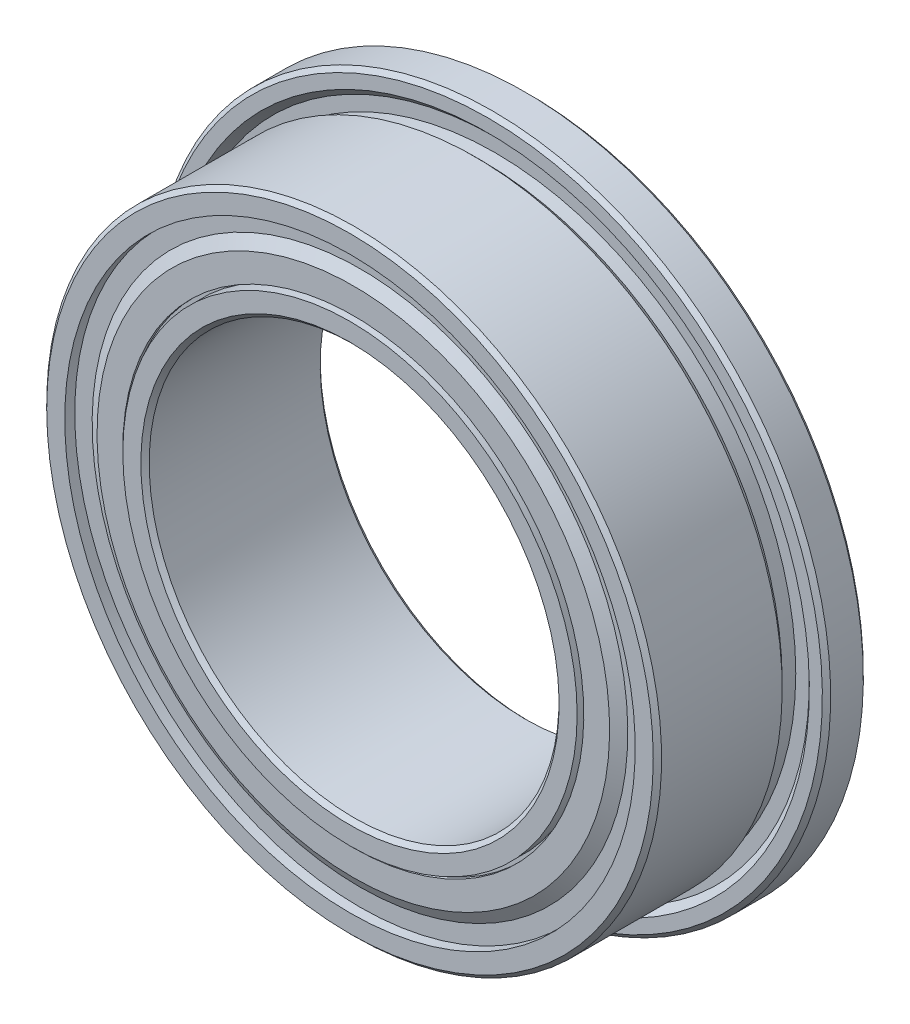
from build123d import *

# Parameters (mm, degrees)
FILLET1_SIZE      = 0.08125
FILLET2_SIZE      = 0.08125
CIRPATTERN3_COUNT = 22
SKETCH8_W         = 0.26
SKETCH8_H         = 0.216666667


with BuildPart() as part:
    # Sketch2 → Revolve1 (revolve)
    with BuildSketch(Plane(origin=(0, 0, 0), x_dir=(0, 0, -1), z_dir=(1, 0, 0))):
        with BuildLine():
            Line((1.75, 6.6), (0.95, 6.6))
            Line((0.95, 6.6), (0.95, 6.265165043))
            Line((0.95, 6.265165043), (1.082582521, 6.132582521))
            Line((1.082582521, 6.132582521), (1.082582521, 5.867417479))
            Line((1.082582521, 5.867417479), (0.817417479, 5.867417479))
            Line((0.817417479, 5.867417479), (0.684834957, 6))
            Line((0.684834957, 6), (-1.75, 6))
            Line((-1.75, 6), (-1.75, 5.35))
            Line((-1.75, 5.35), (-0.487339717, 5.35))
            ThreePointArc((-0.487339717, 5.35), (0, 5.6), (0.487339717, 5.35))
            Line((0.487339717, 5.35), (1.75, 5.35))
            Line((1.75, 5.35), (1.75, 6.6))
        make_face()
        with BuildLine():
            Line((1.75, 4), (-1.75, 4))
            Line((-1.75, 4), (-1.75, 4.65))
            Line((-1.75, 4.65), (-0.487339717, 4.65))
            ThreePointArc((-0.487339717, 4.65), (0, 4.4), (0.487339717, 4.65))
            Line((0.487339717, 4.65), (1.75, 4.65))
            Line((1.75, 4.65), (1.75, 4))
        make_face()
    revolve(axis=Axis((0, 0, 0), (0, 0, -1)))

    # Fillet1
    fillet1_edges = [part.edges().sort_by_distance(p)[0] for p in [
        (0, -6.6, -1.75),
        (0, -6.6, -0.95),
        (0, -6, 1.75),
    ]]
    chamfer(fillet1_edges, length=FILLET1_SIZE)

    # Fillet2
    fillet2_edges = [part.edges().sort_by_distance(p)[0] for p in [
        (0, -4, -1.75),
        (0, -4, 1.75),
    ]]
    chamfer(fillet2_edges, length=FILLET2_SIZE)

    # Sketch8 → Cut-Revolve1 (revolve, cut)
    with BuildSketch(Plane(origin=(0, 0, 0), x_dir=(0, 0, -1), z_dir=(1, 0, 0))):
        with Locations((-1.62, 5.458333334)):
            Rectangle(SKETCH8_W, SKETCH8_H)
        with Locations((1.62, 5.458333334)):
            Rectangle(SKETCH8_W, SKETCH8_H)
        with Locations((1.62, 4.541666667)):
            Rectangle(SKETCH8_W, SKETCH8_H)
        with Locations((-1.62, 4.541666667)):
            Rectangle(SKETCH8_W, SKETCH8_H)
    revolve(axis=Axis((0, 0, 0), (0, 0, -1)), mode=Mode.SUBTRACT)


with BuildPart() as body_2:
    # Sketch7 → Revolve3 (revolve)
    with BuildSketch(Plane.XY):
        with BuildLine():
            Line((0, 5.6), (0, 4.4))
            ThreePointArc((0, 4.4), (-0.6, 5), (0, 5.6))
        make_face()
    revolve(axis=Axis((0, 5.6, 0), (0, -1, 0)))


with BuildPart() as cirpattern3_1:
    # CirPattern3: pattern copy
    add(body_2.part.rotate(Axis((0, 0, 0), (0, 0, -1)), 1 * 360 / CIRPATTERN3_COUNT))


with BuildPart() as cirpattern3_2:
    # CirPattern3: pattern copy
    add(body_2.part.rotate(Axis((0, 0, 0), (0, 0, -1)), 2 * 360 / CIRPATTERN3_COUNT))


with BuildPart() as cirpattern3_3:
    # CirPattern3: pattern copy
    add(body_2.part.rotate(Axis((0, 0, 0), (0, 0, -1)), 3 * 360 / CIRPATTERN3_COUNT))


with BuildPart() as cirpattern3_4:
    # CirPattern3: pattern copy
    add(body_2.part.rotate(Axis((0, 0, 0), (0, 0, -1)), 4 * 360 / CIRPATTERN3_COUNT))


with BuildPart() as cirpattern3_5:
    # CirPattern3: pattern copy
    add(body_2.part.rotate(Axis((0, 0, 0), (0, 0, -1)), 5 * 360 / CIRPATTERN3_COUNT))


with BuildPart() as cirpattern3_6:
    # CirPattern3: pattern copy
    add(body_2.part.rotate(Axis((0, 0, 0), (0, 0, -1)), 6 * 360 / CIRPATTERN3_COUNT))


with BuildPart() as cirpattern3_7:
    # CirPattern3: pattern copy
    add(body_2.part.rotate(Axis((0, 0, 0), (0, 0, -1)), 7 * 360 / CIRPATTERN3_COUNT))


with BuildPart() as cirpattern3_8:
    # CirPattern3: pattern copy
    add(body_2.part.rotate(Axis((0, 0, 0), (0, 0, -1)), 8 * 360 / CIRPATTERN3_COUNT))


with BuildPart() as cirpattern3_9:
    # CirPattern3: pattern copy
    add(body_2.part.rotate(Axis((0, 0, 0), (0, 0, -1)), 9 * 360 / CIRPATTERN3_COUNT))


with BuildPart() as cirpattern3_10:
    # CirPattern3: pattern copy
    add(body_2.part.rotate(Axis((0, 0, 0), (0, 0, -1)), 10 * 360 / CIRPATTERN3_COUNT))


with BuildPart() as cirpattern3_11:
    # CirPattern3: pattern copy
    add(body_2.part.rotate(Axis((0, 0, 0), (0, 0, -1)), 11 * 360 / CIRPATTERN3_COUNT))


with BuildPart() as cirpattern3_12:
    # CirPattern3: pattern copy
    add(body_2.part.rotate(Axis((0, 0, 0), (0, 0, -1)), 12 * 360 / CIRPATTERN3_COUNT))


with BuildPart() as cirpattern3_13:
    # CirPattern3: pattern copy
    add(body_2.part.rotate(Axis((0, 0, 0), (0, 0, -1)), 13 * 360 / CIRPATTERN3_COUNT))


with BuildPart() as cirpattern3_14:
    # CirPattern3: pattern copy
    add(body_2.part.rotate(Axis((0, 0, 0), (0, 0, -1)), 14 * 360 / CIRPATTERN3_COUNT))


with BuildPart() as cirpattern3_15:
    # CirPattern3: pattern copy
    add(body_2.part.rotate(Axis((0, 0, 0), (0, 0, -1)), 15 * 360 / CIRPATTERN3_COUNT))


with BuildPart() as cirpattern3_16:
    # CirPattern3: pattern copy
    add(body_2.part.rotate(Axis((0, 0, 0), (0, 0, -1)), 16 * 360 / CIRPATTERN3_COUNT))


with BuildPart() as cirpattern3_17:
    # CirPattern3: pattern copy
    add(body_2.part.rotate(Axis((0, 0, 0), (0, 0, -1)), 17 * 360 / CIRPATTERN3_COUNT))


with BuildPart() as cirpattern3_18:
    # CirPattern3: pattern copy
    add(body_2.part.rotate(Axis((0, 0, 0), (0, 0, -1)), 18 * 360 / CIRPATTERN3_COUNT))


with BuildPart() as cirpattern3_19:
    # CirPattern3: pattern copy
    add(body_2.part.rotate(Axis((0, 0, 0), (0, 0, -1)), 19 * 360 / CIRPATTERN3_COUNT))


with BuildPart() as cirpattern3_20:
    # CirPattern3: pattern copy
    add(body_2.part.rotate(Axis((0, 0, 0), (0, 0, -1)), 20 * 360 / CIRPATTERN3_COUNT))


with BuildPart() as cirpattern3_21:
    # CirPattern3: pattern copy
    add(body_2.part.rotate(Axis((0, 0, 0), (0, 0, -1)), 21 * 360 / CIRPATTERN3_COUNT))


with BuildPart() as body_24:
    # Sketch9 → Revolve4 (revolve)
    with BuildSketch(Plane(origin=(0, 0, 0), x_dir=(0, 0, -1), z_dir=(1, 0, 0))):
        Polygon((-1.49, 5.566666667), (-1.49, 5.20952381), (-1.62, 4.984357205), (-1.62, 4.498333333), (-1.685, 4.498333333), (-1.685, 5.001773902), (-1.555, 5.226940507), (-1.555, 5.566666667), align=None)
        Polygon((1.49, 5.566666667), (1.49, 5.20952381), (1.62, 4.984357205), (1.62, 4.498333333), (1.685, 4.498333333), (1.685, 5.001773902), (1.555, 5.226940507), (1.555, 5.566666667), align=None)
    revolve(axis=Axis((0, 0, 0), (0, 0, -1)))


solid = Compound([part.part, body_2.part, cirpattern3_1.part, cirpattern3_2.part, cirpattern3_3.part, cirpattern3_4.part, cirpattern3_5.part, cirpattern3_6.part, cirpattern3_7.part, cirpattern3_8.part, cirpattern3_9.part, cirpattern3_10.part, cirpattern3_11.part, cirpattern3_12.part, cirpattern3_13.part, cirpattern3_14.part, cirpattern3_15.part, cirpattern3_16.part, cirpattern3_17.part, cirpattern3_18.part, cirpattern3_19.part, cirpattern3_20.part, cirpattern3_21.part, body_24.part])
